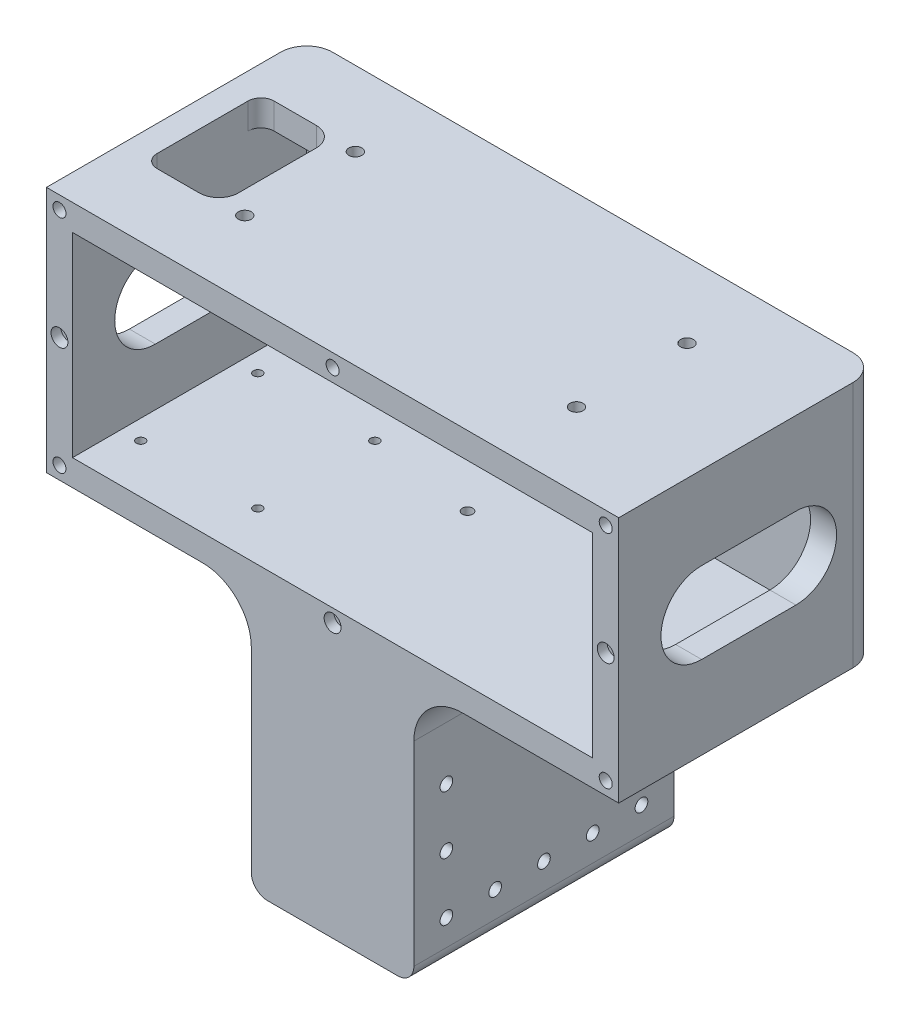
from build123d import *

# Parameters (mm, degrees)
SKETCH_1_W           = 176
SKETCH_1_H           = 80
EXTRUDE_1_DEPTH      = 76
SKETCH_3_W           = 160
SKETCH_3_H           = 60
CUT_EXTRUDE_1_DEPTH  = 72
FILLET_1_R           = 8
SKETCH_5_R           = 1.35
CUT_EXTRUDE_3_DEPTH  = 119.186293622
SKETCH_6_R           = 2
CUT_EXTRUDE_4_DEPTH  = 8
SKETCH_7_R           = 1.6
CUT_EXTRUDE_5_DEPTH  = 119.186293622
SKETCH_8_R           = 2.5
SKETCH_8_R_2         = 3
CUT_EXTRUDE_6_DEPTH  = 4
CUT_EXTRUDE_8_DEPTH  = 2
SKETCH_11_R          = 2
CUT_EXTRUDE_9_DEPTH  = 8
SKETCH_11_3_R        = 2.6
CUT_EXTRUDE_10_DEPTH = 3
CUT_EXTRUDE1_DEPTH   = 196.836666698
SKETCH2_W            = 50
SKETCH2_H            = 80
BOSS_EXTRUDE1_DEPTH  = 80
FILLET1_R            = 15
FILLET2_R            = 5
SKETCH_4_R           = 1.95
CUT_EXTRUDE_2_DEPTH  = 8
CUT_EXTRUDE2_START   = -42
SKETCH_4_2_R         = 1.95
CUT_EXTRUDE2_DEPTH   = 8


with BuildPart() as part:
    # 草图1 → 凸台-拉伸1 (new body)
    with BuildSketch(Plane(origin=(0, 0, 0), x_dir=(1, 0, 0), z_dir=(0, 1, 0))):
        Rectangle(SKETCH_1_W, SKETCH_1_H)
    extrude(amount=EXTRUDE_1_DEPTH)

    # 草图3 → 切除-拉伸1 (cut)
    with BuildSketch(Plane.XY.offset(40)):
        with Locations((0, 38)):
            Rectangle(SKETCH_3_W, SKETCH_3_H)
    extrude(amount=-CUT_EXTRUDE_1_DEPTH, mode=Mode.SUBTRACT)

    # 圆角1
    fillet_1_edges = [part.edges().sort_by_distance(p)[0] for p in [
        (-88, 38, -40),
        (88, 38, -40),
    ]]
    fillet(fillet_1_edges, radius=FILLET_1_R)

    # 草图5 → 切除-拉伸3 (cut, through all)
    with BuildSketch(Plane(origin=(0, 8, 0), x_dir=(1, 0, 0), z_dir=(0, 1, 0))):
        with Locations(Location((-74, 11, 0), (0, 0, 180))):
            Circle(SKETCH_5_R)
        with Locations((-38, 11)):
            Circle(SKETCH_5_R)
        with Locations(Location((-38, -25, 0), (0, 0, 180))):
            Circle(SKETCH_5_R)
        with Locations((-74, -25)):
            Circle(SKETCH_5_R)
    extrude(amount=-CUT_EXTRUDE_3_DEPTH, mode=Mode.SUBTRACT)

    # 草图6 → 切除-拉伸4 (cut)
    with BuildSketch(Plane(origin=(0, 76, 0), x_dir=(1, 0, 0), z_dir=(0, 1, 0))):
        with BuildLine():
            ThreePointArc((-63, -18), (-67.242640687, -16.242640687), (-69, -12))
            Line((-69, -12), (-69, 12))
            ThreePointArc((-69, 12), (-67.242640687, 16.242640687), (-63, 18))
            Line((-63, 18), (-76, 18))
            ThreePointArc((-76, 18), (-78.828427125, 16.828427125), (-80, 14))
            Line((-80, 14), (-80, -14))
            ThreePointArc((-80, -14), (-78.828427125, -16.828427125), (-76, -18))
            Line((-76, -18), (-63, -18))
        make_face()
        with BuildLine():
            Line((-69, 12), (-69, -12))
            ThreePointArc((-69, -12), (-67.242640687, -16.242640687), (-63, -18))
            Line((-63, -18), (-63, 18))
            ThreePointArc((-63, 18), (-67.242640687, 16.242640687), (-69, 12))
        make_face()
        with BuildLine():
            Line((-63, 18), (-63, -18))
            ThreePointArc((-63, -18), (-58.757359313, -16.242640687), (-57, -12))
            Line((-57, -12), (-57, 12))
            ThreePointArc((-57, 12), (-58.757359313, 16.242640687), (-63, 18))
        make_face()
        with Locations(Location((-50, 17, 0), (0, 0, 270))):
            Circle(SKETCH_6_R)
        with Locations(Location((-50, -17, 0), (0, 0, 270))):
            Circle(SKETCH_6_R)
        with Locations(Location((52, 17, 0), (0, 0, 270))):
            Circle(SKETCH_6_R)
        with Locations(Location((52, -17, 0), (0, 0, 270))):
            Circle(SKETCH_6_R)
    extrude(amount=-CUT_EXTRUDE_4_DEPTH, mode=Mode.SUBTRACT)

    # 草图7 → 切除-拉伸5 (cut, through all)
    with BuildSketch(Plane(origin=(0, 8, 0), x_dir=(1, 0, 0), z_dir=(0, 1, 0))):
        with Locations(Location((70, 23, 0), (0, 0, 180))):
            Circle(SKETCH_7_R)
        with Locations(Location((70, -10, 0), (0, 0, 180))):
            Circle(SKETCH_7_R)
        with Locations(Location((-5, 6.5, 0), (0, 0, 180))):
            Circle(SKETCH_7_R)
    extrude(amount=-CUT_EXTRUDE_5_DEPTH, mode=Mode.SUBTRACT)

    # 草图8 → 切除-拉伸6 (cut)
    with BuildSketch(Plane.XZ):
        with Locations(Location((-74, 25, 0), (0, 0, 270))):
            Circle(SKETCH_8_R)
        with Locations(Location((-38, 25, 0), (0, 0, 90))):
            Circle(SKETCH_8_R)
        with Locations(Location((-38, -11, 0), (0, 0, 270))):
            Circle(SKETCH_8_R)
        with Locations(Location((-74, -11, 0), (0, 0, 90))):
            Circle(SKETCH_8_R)
        with Locations(Location((-5, -6.5, 0), (0, 0, 270))):
            Circle(SKETCH_8_R_2)
        with Locations(Location((70, 10, 0), (0, 0, 270))):
            Circle(SKETCH_8_R_2)
        with Locations(Location((70, -23, 0), (0, 0, 270))):
            Circle(SKETCH_8_R_2)
    extrude(amount=-CUT_EXTRUDE_6_DEPTH, mode=Mode.SUBTRACT)

    # 草图10 → 切除-拉伸8 (cut)
    # profile 1 of 6: a face of its own
    with BuildSketch(Plane(origin=(0, 0, -40), x_dir=(-1, 0, 0), z_dir=(0, 0, -1))):
        with BuildLine():
            Line((-50.893333333, 27), (-61.16, 27))
            Line((-61.16, 27), (-61.16, 28.173333333))
            add(Edge.make_bspline(
                [(-61.16, 28.173333333), (-60.952112142, 28.180487852), (-60.555641127, 28.194132512), (-59.99587346, 28.244548421), (-59.499819668, 28.312277517), (-59.07290631, 28.397220013), (-58.724563275, 28.513301064), (-58.459894229, 28.646408041), (-58.286995174, 28.832568195), (-58.264772394, 28.978909316), (-58.254166667, 29.04875)],
                knots=[0, 0, 0, 0, 1.55077788, 2.957548773, 4.188379406, 5.283168379, 6.198199007, 6.917411296, 7.483339098, 8, 8, 8, 8], degree=3))
            add(Edge.make_bspline(
                [(-58.254166667, 29.04875), (-58.260585026, 29.097886579), (-58.27653201, 29.21997077), (-58.34533932, 29.429686108), (-58.465543904, 29.695288105), (-58.618736691, 30.0191066), (-58.801481266, 30.390189812), (-59.024378734, 30.785931448), (-59.265744563, 31.209475274), (-59.441892444, 31.495245314), (-59.532916667, 31.642916667)],
                knots=[0, 0, 0, 0, 0.408681915, 1.015406497, 1.812353963, 2.817067619, 3.973889607, 5.227672225, 6.567402679, 8, 8, 8, 8], degree=3))
            add(Edge.make_bspline(
                [(-59.532916667, 31.642916667), (-59.644543076, 31.81854873), (-59.877350015, 32.184845232), (-60.238193295, 32.757017928), (-60.628646688, 33.373137696), (-61.186551902, 34.243787218), (-61.886221131, 35.346284591), (-62.474632648, 36.209441376), (-62.764166667, 36.634166667)],
                knots=[0, 0, 0, 0, 0.629951914, 1.313821509, 2.047701607, 2.837979894, 4.444095054, 6, 6, 6, 6], degree=3))
            add(Edge.make_bspline(
                [(-62.764166667, 36.634166667), (-63.009835353, 36.315785189), (-63.522447559, 35.651450496), (-64.298154348, 34.59492817), (-65.128057009, 33.450387269), (-65.835734143, 32.451764527), (-66.387065241, 31.653510431), (-66.756847548, 31.114182322), (-67.063209667, 30.634839465), (-67.32005826, 30.226011781), (-67.521171509, 29.883441054), (-67.656375705, 29.604831258), (-67.75746126, 29.397405203), (-67.775702759, 29.272365659), (-67.782916667, 29.222916667)],
                knots=[0, 0, 0, 0, 1.612784575, 3.365235798, 5.256389622, 7.28285987, 8.273760362, 9.147282428, 9.905311661, 10.554805674, 11.08452502, 11.495556935, 11.8005095, 12, 12, 12, 12], degree=3))
            add(Edge.make_bspline(
                [(-67.782916667, 29.222916667), (-67.777543085, 29.142299251), (-67.767176344, 28.98677174), (-67.661316359, 28.770686837), (-67.489923465, 28.595990823), (-67.299227519, 28.477726547), (-67.102875684, 28.411915187), (-66.914567164, 28.35441139), (-66.685570253, 28.311050915), (-66.417310947, 28.2771453), (-66.112259677, 28.237816954), (-65.766438834, 28.213037015), (-65.382964998, 28.189627347), (-65.11391683, 28.178925356), (-64.973333333, 28.173333333)],
                knots=[0, 0, 0, 0, 0.87771759, 1.693297064, 2.568939857, 3.530052873, 4.117451916, 4.83208502, 5.685064082, 6.664491151, 7.79324832, 9.051878884, 10.45954285, 12, 12, 12, 12], degree=3))
            Line((-64.973333333, 28.173333333), (-64.973333333, 27))
            Line((-64.973333333, 27), (-73.186666667, 27))
            Line((-73.186666667, 27), (-73.186666667, 28.173333333))
            add(Edge.make_bspline(
                [(-73.186666667, 28.173333333), (-73.03533938, 28.188226277), (-72.694055691, 28.221813867), (-72.160753978, 28.283688703), (-71.617685691, 28.373760749), (-71.287557056, 28.510226341), (-71.137916667, 28.572083333)],
                knots=[0, 0, 0, 0, 0.869842477, 1.961728483, 3.076094254, 4, 4, 4, 4], degree=3))
            add(Edge.make_bspline(
                [(-71.137916667, 28.572083333), (-71.009774798, 28.643272699), (-70.760417814, 28.781803263), (-70.421553975, 29.017507115), (-70.111669198, 29.24854916), (-69.758553642, 29.59216709), (-69.33824889, 30.063539395), (-69.026945226, 30.468965021), (-68.864583333, 30.680416667)],
                knots=[0, 0, 0, 0, 0.842303229, 1.639075457, 2.371817038, 3.061590333, 4.467458589, 6, 6, 6, 6], degree=3))
            add(Edge.make_bspline(
                [(-68.864583333, 30.680416667), (-68.686558781, 30.920825244), (-68.30940849, 31.430137941), (-67.695630293, 32.226380512), (-67.019598511, 33.111195462), (-66.288711741, 34.055247826), (-65.544036844, 35.016436805), (-64.828382469, 35.958246428), (-64.155835525, 36.852192487), (-63.727594315, 37.437333089), (-63.520416667, 37.720416667)],
                knots=[0, 0, 0, 0, 0.812243646, 1.72076224, 2.729689795, 3.835742579, 4.962534863, 6.031166572, 7.047503441, 8, 8, 8, 8], degree=3))
            add(Edge.make_bspline(
                [(-63.520416667, 37.720416667), (-63.680591655, 37.954333271), (-64.021303208, 38.451902149), (-64.567633105, 39.238551798), (-65.17171939, 40.115659567), (-65.836170012, 41.068492158), (-66.540999269, 42.084587468), (-67.266296542, 43.151932602), (-68.030818684, 44.243166048), (-68.541333578, 44.987614018), (-68.800416667, 45.365416667)],
                knots=[0, 0, 0, 0, 0.732313684, 1.557719685, 2.473978017, 3.483336423, 4.558335994, 5.668291013, 6.816672396, 8, 8, 8, 8], degree=3))
            add(Edge.make_bspline(
                [(-68.800416667, 45.365416667), (-68.903542432, 45.515678528), (-69.094513643, 45.793937697), (-69.370229979, 46.172114524), (-69.610386258, 46.479272062), (-69.827338515, 46.725756309), (-70.036524781, 46.938191298), (-70.280054972, 47.111912257), (-70.543848517, 47.286246289), (-70.739396562, 47.379790866), (-70.84, 47.427916667)],
                knots=[0, 0, 0, 0, 1.485103007, 2.750155792, 3.813775997, 4.660588893, 5.426569177, 6.235847683, 7.092398042, 8, 8, 8, 8], degree=3))
            add(Edge.make_bspline(
                [(-70.84, 47.427916667), (-70.906653124, 47.457009281), (-71.047839895, 47.518634184), (-71.287757308, 47.583409327), (-71.558892445, 47.649855836), (-71.857415254, 47.693098526), (-72.153439237, 47.739668619), (-72.429010498, 47.773681985), (-72.671134617, 47.809860562), (-72.822968531, 47.821344592), (-72.893333333, 47.826666667)],
                knots=[0, 0, 0, 0, 0.830174623, 1.758502331, 2.834418257, 4.02009335, 5.203064799, 6.260108559, 7.193677397, 8, 8, 8, 8], degree=3))
            Line((-72.893333333, 47.826666667), (-72.893333333, 49))
            Line((-72.893333333, 49), (-62.626666667, 49))
            Line((-62.626666667, 49), (-62.626666667, 47.826666667))
            add(Edge.make_bspline(
                [(-62.626666667, 47.826666667), (-62.958752228, 47.806864988), (-63.633378221, 47.766638225), (-64.453510118, 47.646628022), (-65.054444563, 47.513621874), (-65.377991761, 47.385804399), (-65.612087545, 47.228198659), (-65.645889425, 47.077470627), (-65.660833333, 47.010833333)],
                knots=[0, 0, 0, 0, 1.823965672, 3.705354272, 4.551126633, 5.178536223, 5.63682852, 6, 6, 6, 6], degree=3))
            add(Edge.make_bspline(
                [(-65.660833333, 47.010833333), (-65.655289714, 46.952336547), (-65.642152941, 46.813716112), (-65.557865387, 46.585421012), (-65.439878611, 46.300006099), (-65.202736118, 45.838162208), (-64.838533425, 45.198669644), (-64.518242182, 44.679964688), (-64.35, 44.4075)],
                knots=[0, 0, 0, 0, 0.359449428, 0.851790998, 1.482307005, 2.258221073, 4.034523058, 6, 6, 6, 6], degree=3))
            add(Edge.make_bspline(
                [(-64.35, 44.4075), (-64.154184023, 44.099054343), (-63.742329382, 43.450308627), (-63.217039306, 42.613055084), (-62.750702473, 41.889073794), (-62.356766464, 41.291980913), (-61.920216487, 40.657701758), (-61.618361932, 40.219839308), (-61.4625, 39.99375)],
                knots=[0, 0, 0, 0, 1.246692748, 2.622136376, 3.372642514, 4.18523793, 5.062951616, 6, 6, 6, 6], degree=3))
            add(Edge.make_bspline(
                [(-61.4625, 39.99375), (-61.171672337, 40.382920525), (-60.606643453, 41.13901293), (-59.792869222, 42.246905218), (-59.049389241, 43.301779315), (-58.466608741, 44.134455793), (-58.0463771, 44.758950955), (-57.779081627, 45.176125126), (-57.54878641, 45.549935986), (-57.369831238, 45.884686319), (-57.214688894, 46.171908536), (-57.120318305, 46.423438805), (-57.042704649, 46.627469361), (-57.034169003, 46.753682421), (-57.030416667, 46.809166667)],
                knots=[0, 0, 0, 0, 2.140744858, 4.15910462, 6.056835027, 7.827150132, 8.637466942, 9.373214314, 10.010505793, 10.570870692, 11.046552371, 11.445326823, 11.756161342, 12, 12, 12, 12], degree=3))
            add(Edge.make_bspline(
                [(-57.030416667, 46.809166667), (-57.037002298, 46.886983573), (-57.050169707, 47.042571848), (-57.174551498, 47.255804721), (-57.382710808, 47.416825287), (-57.659808975, 47.552477742), (-58.027090234, 47.650855787), (-58.489210013, 47.73901374), (-59.056936513, 47.791808421), (-59.47022032, 47.814445788), (-59.693333333, 47.826666667)],
                knots=[0, 0, 0, 0, 0.600284519, 1.200217754, 1.848346211, 2.617089138, 3.581134332, 4.787833379, 6.265898252, 8, 8, 8, 8], degree=3))
            Line((-59.693333333, 47.826666667), (-59.693333333, 49))
            Line((-59.693333333, 49), (-51.48, 49))
            Line((-51.48, 49), (-51.48, 47.826666667))
            add(Edge.make_bspline(
                [(-51.48, 47.826666667), (-51.551838718, 47.82251661), (-51.706400252, 47.813587732), (-51.952370227, 47.789731883), (-52.23080896, 47.758089961), (-52.625874857, 47.69801973), (-53.09983943, 47.618242149), (-53.450644598, 47.487687235), (-53.61125, 47.427916667)],
                knots=[0, 0, 0, 0, 0.594910082, 1.279953456, 2.04301135, 2.911222787, 4.585897952, 6, 6, 6, 6], degree=3))
            add(Edge.make_bspline(
                [(-53.61125, 47.427916667), (-53.741930752, 47.363836106), (-53.990719674, 47.241840071), (-54.333505741, 47.042430096), (-54.618902368, 46.827492292), (-54.860029175, 46.593766864), (-55.085320409, 46.332066075), (-55.340807113, 46.037279069), (-55.626386372, 45.691776705), (-55.825409131, 45.442132744), (-55.930416667, 45.310416667)],
                knots=[0, 0, 0, 0, 1.097953283, 2.090274278, 2.987021028, 3.785909167, 4.618668917, 5.59131528, 6.729140082, 8, 8, 8, 8], degree=3))
            add(Edge.make_bspline(
                [(-55.930416667, 45.310416667), (-56.33030899, 44.80255797), (-57.102992771, 43.821258368), (-58.048040638, 42.588434372), (-58.79477748, 41.596221548), (-59.401473174, 40.793885853), (-60.059789197, 39.914146991), (-60.518261217, 39.303140199), (-60.756666667, 38.985416667)],
                knots=[0, 0, 0, 0, 1.462379986, 2.82565388, 3.514168065, 4.271809583, 5.101340983, 6, 6, 6, 6], degree=3))
            add(Edge.make_bspline(
                [(-60.756666667, 38.985416667), (-60.544452331, 38.681287429), (-60.106200655, 38.053218888), (-59.425459901, 37.08380398), (-58.718862296, 36.047323257), (-57.731401296, 34.60699026), (-56.50314759, 32.814365074), (-55.526856234, 31.383349403), (-55.050416667, 30.685)],
                knots=[0, 0, 0, 0, 0.66271119, 1.368589395, 2.116773407, 2.90432888, 4.489282734, 6, 6, 6, 6], degree=3))
            add(Edge.make_bspline(
                [(-55.050416667, 30.685), (-54.881972662, 30.455468543), (-54.542538827, 29.992936542), (-54.058533594, 29.471343442), (-53.674461537, 29.085702946), (-53.403688835, 28.852558671), (-53.172312154, 28.656454312), (-53.016397944, 28.556986235), (-52.946666667, 28.5125)],
                knots=[0, 0, 0, 0, 1.684639267, 3.394739792, 4.207221132, 4.905962465, 5.510701206, 6, 6, 6, 6], degree=3))
            add(Edge.make_bspline(
                [(-52.946666667, 28.5125), (-52.880214228, 28.478585874), (-52.740488572, 28.407276626), (-52.505044263, 28.333430124), (-52.240459092, 28.270847968), (-51.859368462, 28.231962666), (-51.407289013, 28.194608229), (-51.053823571, 28.179976733), (-50.893333333, 28.173333333)],
                knots=[0, 0, 0, 0, 0.63872946, 1.343019063, 2.108947838, 2.96693419, 4.622842869, 6, 6, 6, 6], degree=3))
            Line((-50.893333333, 28.173333333), (-50.893333333, 27))
        make_face()
    # profile 2 of 6: a face of its own
    with BuildSketch(Plane(origin=(0, 0, -40), x_dir=(-1, 0, 0), z_dir=(0, 0, -1))):
        with BuildLine():
            add(Edge.make_bspline(
                [(-27.133333333, 47.826666667), (-27.212857342, 47.821377914), (-27.389215363, 47.809649205), (-27.677947993, 47.770320759), (-28.017649529, 47.715994072), (-28.3923034, 47.640126894), (-28.77368194, 47.550879303), (-29.13079049, 47.434796194), (-29.453169119, 47.302169337), (-29.644708487, 47.185846617), (-29.736666667, 47.13)],
                knots=[0, 0, 0, 0, 0.703259667, 1.559597971, 2.570477534, 3.739349262, 4.933079466, 6.024732126, 7.051672565, 8, 8, 8, 8], degree=3))
            add(Edge.make_bspline(
                [(-29.736666667, 47.13), (-29.820446659, 47.058979321), (-30.001175682, 46.905774509), (-30.197416733, 46.568127207), (-30.356085973, 46.145400374), (-30.466465838, 45.63333105), (-30.551640323, 45.04821645), (-30.608172803, 44.397681697), (-30.645423019, 43.685296819), (-30.650622684, 43.189915204), (-30.653333333, 42.931666667)],
                knots=[0, 0, 0, 0, 0.59365717, 1.280628909, 2.090725397, 3.04605574, 4.121233866, 5.306016212, 6.595593068, 8, 8, 8, 8], degree=3))
            Line((-30.653333333, 42.931666667), (-30.653333333, 33.370833333))
            add(Edge.make_bspline(
                [(-30.653333333, 33.370833333), (-30.661264856, 33.075369451), (-30.676692499, 32.500661189), (-30.821227179, 31.670010948), (-31.059682665, 30.898503171), (-31.396855834, 30.192628211), (-31.810120626, 29.548589138), (-32.276625338, 28.956971842), (-32.812538022, 28.430792445), (-33.209040057, 28.128082554), (-33.407916667, 27.97625)],
                knots=[0, 0, 0, 0, 1.123463632, 2.18525468, 3.1964941, 4.187223885, 5.151611522, 6.103069636, 7.048541886, 8, 8, 8, 8], degree=3))
            add(Edge.make_bspline(
                [(-33.407916667, 27.97625), (-33.611775942, 27.84231288), (-34.013952201, 27.578079968), (-34.655965606, 27.254690283), (-35.307317886, 26.975375721), (-35.977697707, 26.770054429), (-36.643508462, 26.60798403), (-37.29973434, 26.50124366), (-37.940644237, 26.426455994), (-38.363820463, 26.417678858), (-38.573333333, 26.413333333)],
                knots=[0, 0, 0, 0, 1.068066247, 2.107095136, 3.145347213, 4.170194078, 5.175367246, 6.146150552, 7.082166492, 8, 8, 8, 8], degree=3))
            add(Edge.make_bspline(
                [(-38.573333333, 26.413333333), (-38.89439584, 26.419270956), (-39.51970329, 26.430835184), (-40.432175833, 26.527101676), (-41.289972675, 26.69274912), (-42.094558492, 26.914757774), (-42.837234909, 27.199627274), (-43.517835061, 27.532001708), (-44.143815016, 27.898089502), (-44.514799496, 28.190434262), (-44.696666667, 28.33375)],
                knots=[0, 0, 0, 0, 1.176901043, 2.292154872, 3.358808348, 4.37671394, 5.348288585, 6.270154977, 7.151980642, 8, 8, 8, 8], degree=3))
            add(Edge.make_bspline(
                [(-44.696666667, 28.33375), (-44.861804414, 28.48329714), (-45.187594266, 28.778329266), (-45.613887296, 29.270005801), (-45.976186096, 29.794380672), (-46.273948134, 30.347365476), (-46.503326528, 30.924733728), (-46.662169516, 31.517312142), (-46.770042937, 32.120243966), (-46.781106802, 32.528560762), (-46.786666667, 32.73375)],
                knots=[0, 0, 0, 0, 1.062308445, 2.095761364, 3.096693215, 4.097970101, 5.086158535, 6.05350405, 7.021837885, 8, 8, 8, 8], degree=3))
            Line((-46.786666667, 32.73375), (-46.786666667, 45.736666667))
            add(Edge.make_bspline(
                [(-46.786666667, 45.736666667), (-46.794251065, 45.902506997), (-46.808402999, 46.211952987), (-46.924545811, 46.58144425), (-47.084473269, 46.827332058), (-47.243034818, 47.006377505), (-47.456440467, 47.167363495), (-47.618296605, 47.263057286), (-47.703333333, 47.313333333)],
                knots=[0, 0, 0, 0, 1.539303726, 2.872228758, 3.529677156, 4.253335355, 5.082329234, 6, 6, 6, 6], degree=3))
            add(Edge.make_bspline(
                [(-47.703333333, 47.313333333), (-47.851189234, 47.384191065), (-48.173656406, 47.538728641), (-48.70872716, 47.662662767), (-49.230740857, 47.77437405), (-49.56989065, 47.810622795), (-49.72, 47.826666667)],
                knots=[0, 0, 0, 0, 0.93778721, 2.045272384, 3.134828041, 4, 4, 4, 4], degree=3))
            Line((-49.72, 47.826666667), (-49.72, 49))
            Line((-49.72, 49), (-40.626666667, 49))
            Line((-40.626666667, 49), (-40.626666667, 47.826666667))
            add(Edge.make_bspline(
                [(-40.626666667, 47.826666667), (-40.788901115, 47.815440659), (-41.154970645, 47.790110039), (-41.619433473, 47.708063662), (-42.010294801, 47.634387715), (-42.273235131, 47.574691765), (-42.491893937, 47.516466209), (-42.622084149, 47.47421317), (-42.68, 47.455416667)],
                knots=[0, 0, 0, 0, 1.398731851, 3.156130615, 4.05349442, 4.8221908, 5.47604492, 6, 6, 6, 6], degree=3))
            add(Edge.make_bspline(
                [(-42.68, 47.455416667), (-42.762487371, 47.421779791), (-42.919310109, 47.357830282), (-43.124422634, 47.216403142), (-43.283194048, 47.040292322), (-43.427918898, 46.763642436), (-43.531847965, 46.376365436), (-43.550451774, 46.05661092), (-43.56, 45.8925)],
                knots=[0, 0, 0, 0, 0.82896372, 1.576003205, 2.30251532, 3.016626784, 4.46881249, 6, 6, 6, 6], degree=3))
            Line((-43.56, 45.8925), (-43.56, 33.760416667))
            add(Edge.make_bspline(
                [(-43.56, 33.760416667), (-43.548818882, 33.459022702), (-43.525768011, 32.83767218), (-43.405970746, 32.058989001), (-43.248291136, 31.430593029), (-43.076316486, 30.970511193), (-42.861475374, 30.52471101), (-42.680139011, 30.24772865), (-42.588333333, 30.1075)],
                knots=[0, 0, 0, 0, 1.413827893, 2.91473222, 3.684662344, 4.448701255, 5.214619558, 6, 6, 6, 6], degree=3))
            add(Edge.make_bspline(
                [(-42.588333333, 30.1075), (-42.480488413, 29.968226218), (-42.263283112, 29.687721549), (-41.86563472, 29.322998512), (-41.423232097, 28.988198223), (-40.916085359, 28.695846441), (-40.330971385, 28.450369684), (-39.64753618, 28.29604232), (-38.874840727, 28.185627501), (-38.326307706, 28.177577728), (-38.037083333, 28.173333333)],
                knots=[0, 0, 0, 0, 0.819219763, 1.649951375, 2.503982557, 3.399980711, 4.370078102, 5.447182079, 6.65397864, 8, 8, 8, 8], degree=3))
            add(Edge.make_bspline(
                [(-38.037083333, 28.173333333), (-37.760101378, 28.177890698), (-37.226856619, 28.186664523), (-36.465010847, 28.297744707), (-35.768240034, 28.455010866), (-35.146075402, 28.698223086), (-34.589385932, 28.991777679), (-34.095307647, 29.329338769), (-33.655249269, 29.703075427), (-33.416115651, 29.99519463), (-33.297916667, 30.139583333)],
                knots=[0, 0, 0, 0, 1.248434101, 2.403481274, 3.466680099, 4.463775576, 5.407211776, 6.299967416, 7.159707754, 8, 8, 8, 8], degree=3))
            add(Edge.make_bspline(
                [(-33.297916667, 30.139583333), (-33.196036195, 30.278412174), (-32.995655345, 30.551463926), (-32.742868063, 30.986010708), (-32.535153923, 31.428858669), (-32.330409598, 32.031808104), (-32.156455963, 32.797492251), (-32.132066695, 33.420230777), (-32.12, 33.728333333)],
                knots=[0, 0, 0, 0, 0.805127519, 1.583543288, 2.347819015, 3.089226742, 4.559882449, 6, 6, 6, 6], degree=3))
            Line((-32.12, 33.728333333), (-32.12, 42.734583333))
            add(Edge.make_bspline(
                [(-32.12, 42.734583333), (-32.122097615, 43.008112607), (-32.126096976, 43.529629874), (-32.170419372, 44.271803533), (-32.248984035, 44.935579683), (-32.348302889, 45.520695924), (-32.484588887, 46.019525132), (-32.640338386, 46.431676028), (-32.83185002, 46.754702596), (-33.000963679, 46.905533163), (-33.077916667, 46.974166667)],
                knots=[0, 0, 0, 0, 1.473798797, 2.80997902, 4.003670744, 5.074288656, 6.004981979, 6.784625713, 7.446959613, 8, 8, 8, 8], degree=3))
            add(Edge.make_bspline(
                [(-33.077916667, 46.974166667), (-33.172857155, 47.037474093), (-33.372491529, 47.170592625), (-33.714150248, 47.334311025), (-34.106298879, 47.46823915), (-34.526759385, 47.581917209), (-34.942313287, 47.672736654), (-35.31949313, 47.74760672), (-35.643484695, 47.800299001), (-35.843079935, 47.818456273), (-35.933333333, 47.826666667)],
                knots=[0, 0, 0, 0, 0.909286387, 1.911985326, 3.010292361, 4.210400366, 5.383988903, 6.401970183, 7.277399488, 8, 8, 8, 8], degree=3))
            Line((-35.933333333, 47.826666667), (-35.933333333, 49))
            Line((-35.933333333, 49), (-27.133333333, 49))
            Line((-27.133333333, 49), (-27.133333333, 47.826666667))
        make_face()
    # profile 3 of 6: a face of its own
    with BuildSketch(Plane(origin=(0, 0, -40), x_dir=(-1, 0, 0), z_dir=(0, 0, -1))):
        with BuildLine():
            Line((-5.133333333, 27), (-14.185416667, 27))
            Line((-14.185416667, 27), (-14.185416667, 28.173333333))
            add(Edge.make_bspline(
                [(-14.185416667, 28.173333333), (-13.992754499, 28.186903011), (-13.623506906, 28.212910043), (-13.095943838, 28.277271766), (-12.619320778, 28.357406296), (-12.203635803, 28.456885697), (-11.854656412, 28.562221974), (-11.604366857, 28.690846178), (-11.422789671, 28.830314593), (-11.396708799, 28.952600653), (-11.385, 29.0075)],
                knots=[0, 0, 0, 0, 1.522462248, 2.917882252, 4.189202903, 5.328601012, 6.292288942, 7.041222743, 7.569564626, 8, 8, 8, 8], degree=3))
            add(Edge.make_bspline(
                [(-11.385, 29.0075), (-11.387329944, 29.056465308), (-11.392445111, 29.163963892), (-11.417096715, 29.33201436), (-11.445940526, 29.506374607), (-11.48869186, 29.616044775), (-11.50875, 29.6675)],
                knots=[0, 0, 0, 0, 0.871039179, 1.912282025, 3.020481126, 4, 4, 4, 4], degree=3))
            Line((-11.50875, 29.6675), (-13.232083333, 34.333333333))
            Line((-13.232083333, 34.333333333), (-21.097083333, 34.333333333))
            add(Edge.make_bspline(
                [(-21.097083333, 34.333333333), (-21.161322594, 34.168363134), (-21.286099295, 33.847929226), (-21.465103648, 33.38470129), (-21.621147333, 32.951782021), (-21.800383776, 32.430927878), (-21.998180935, 31.828180536), (-22.151313023, 31.358769462), (-22.224583333, 31.134166667)],
                knots=[0, 0, 0, 0, 0.939236489, 1.824349009, 2.634555097, 3.380463254, 4.746609722, 6, 6, 6, 6], degree=3))
            add(Edge.make_bspline(
                [(-22.224583333, 31.134166667), (-22.280715509, 30.945399306), (-22.381455223, 30.606620884), (-22.482101771, 30.143446848), (-22.544739545, 29.776149296), (-22.554755006, 29.560724653), (-22.559166667, 29.465833333)],
                knots=[0, 0, 0, 0, 1.384376075, 2.484522436, 3.332454899, 4, 4, 4, 4], degree=3))
            add(Edge.make_bspline(
                [(-22.559166667, 29.465833333), (-22.547290414, 29.371144259), (-22.522414161, 29.172806505), (-22.311125296, 28.915057191), (-21.993987226, 28.706459571), (-21.575321071, 28.537829749), (-21.084177675, 28.405192372), (-20.550785011, 28.28852912), (-19.983637754, 28.211386263), (-19.595482576, 28.186222431), (-19.396666667, 28.173333333)],
                knots=[0, 0, 0, 0, 0.616631876, 1.291610267, 2.09964896, 3.103309702, 4.241537626, 5.443230288, 6.690403929, 8, 8, 8, 8], degree=3))
            Line((-19.396666667, 28.173333333), (-19.396666667, 27))
            Line((-19.396666667, 27), (-27.426666667, 27))
            Line((-27.426666667, 27), (-27.426666667, 28.173333333))
            add(Edge.make_bspline(
                [(-27.426666667, 28.173333333), (-27.276539545, 28.190912135), (-26.943239288, 28.229939187), (-26.431501412, 28.343719487), (-25.912130322, 28.488222504), (-25.603280328, 28.658376018), (-25.460416667, 28.737083333)],
                knots=[0, 0, 0, 0, 0.879562297, 1.952734036, 3.053003347, 4, 4, 4, 4], degree=3))
            add(Edge.make_bspline(
                [(-25.460416667, 28.737083333), (-25.363491115, 28.806415036), (-25.176518334, 28.940158316), (-24.916143242, 29.149560984), (-24.697740054, 29.370033679), (-24.504473865, 29.598001795), (-24.337889353, 29.854728724), (-24.173329899, 30.14424334), (-24.007588652, 30.473883677), (-23.908215614, 30.711823173), (-23.85625, 30.83625)],
                knots=[0, 0, 0, 0, 1.063050284, 2.050661185, 2.975742165, 3.827229948, 4.711668566, 5.700501003, 6.797512097, 8, 8, 8, 8], degree=3))
            add(Edge.make_bspline(
                [(-23.85625, 30.83625), (-23.575648925, 31.534040232), (-22.997930381, 32.97069316), (-22.126651948, 35.194942882), (-21.203382653, 37.540217432), (-20.416118467, 39.564015841), (-19.777261306, 41.209930169), (-19.305519515, 42.424646216), (-18.844751971, 43.604674137), (-18.403718998, 44.75188412), (-17.96987755, 45.862939183), (-17.555918438, 46.940305234), (-17.144399049, 47.979657089), (-16.881397845, 48.663676117), (-16.752083333, 49)],
                knots=[0, 0, 0, 0, 1.388211397, 2.858133975, 4.409234111, 6.040487558, 6.866335122, 7.668090499, 8.445753791, 9.204583141, 9.936690537, 10.647334753, 11.334910858, 12, 12, 12, 12], degree=3))
            Line((-16.752083333, 49), (-15.532916667, 49))
            Line((-15.532916667, 49), (-8.31875, 30.364166667))
            add(Edge.make_bspline(
                [(-8.31875, 30.364166667), (-8.243450856, 30.182653505), (-8.10376147, 29.845923753), (-7.814289749, 29.395932775), (-7.443182171, 29.015449607), (-7.150696169, 28.80426793), (-6.994166667, 28.69125)],
                knots=[0, 0, 0, 0, 1.083661826, 2.010329023, 2.935189362, 4, 4, 4, 4], degree=3))
            add(Edge.make_bspline(
                [(-6.994166667, 28.69125), (-6.859865453, 28.621563766), (-6.567011637, 28.469607735), (-6.080584643, 28.323668568), (-5.594380994, 28.213479502), (-5.275850286, 28.185743134), (-5.133333333, 28.173333333)],
                knots=[0, 0, 0, 0, 0.931184218, 2.030516657, 3.118814113, 4, 4, 4, 4], degree=3))
            Line((-5.133333333, 28.173333333), (-5.133333333, 27))
        make_face()
        Polygon((-13.8325, 35.8), (-17.20125, 44.416666667), (-20.519583333, 35.8), align=None, mode=Mode.SUBTRACT)
    # profile 4 of 6: a face of its own
    with BuildSketch(Plane(origin=(0, 0, -40), x_dir=(-1, 0, 0), z_dir=(0, 0, -1))):
        with BuildLine():
            add(Edge.make_bspline(
                [(18.04, 47.826666667), (17.964924728, 47.822221099), (17.796698263, 47.812259603), (17.521226541, 47.753743169), (17.191060136, 47.684384924), (16.829736888, 47.580527455), (16.469454488, 47.468741245), (16.149652478, 47.350125155), (15.883275283, 47.236252824), (15.736653728, 47.140963928), (15.670416667, 47.097916667)],
                knots=[0, 0, 0, 0, 0.721636794, 1.617022543, 2.699651884, 3.963875089, 5.226563525, 6.322642193, 7.242244757, 8, 8, 8, 8], degree=3))
            add(Edge.make_bspline(
                [(15.670416667, 47.097916667), (15.587649235, 47.022359857), (15.410728176, 46.860851995), (15.231641779, 46.512506046), (15.079564658, 46.092798587), (14.976930133, 45.584143492), (14.90076694, 44.999087717), (14.85637981, 44.336123668), (14.814783017, 43.601344509), (14.813830508, 43.086048908), (14.813333333, 42.817083333)],
                knots=[0, 0, 0, 0, 0.597115289, 1.276374863, 2.069944957, 2.992955396, 4.051532198, 5.23550416, 6.557033648, 8, 8, 8, 8], degree=3))
            Line((14.813333333, 42.817083333), (14.813333333, 26.706666667))
            Line((14.813333333, 26.706666667), (13.497916667, 26.706666667))
            Line((13.497916667, 26.706666667), (0.146666667, 44.769583333))
            Line((0.146666667, 44.769583333), (0.146666667, 33.480833333))
            add(Edge.make_bspline(
                [(0.146666667, 33.480833333), (0.148473363, 33.182841344), (0.151866911, 32.623117825), (0.197881973, 31.838573244), (0.267924527, 31.163361631), (0.365953561, 30.590926293), (0.497750223, 30.108917838), (0.664667488, 29.707516097), (0.848888238, 29.366836871), (1.01669364, 29.194000082), (1.095416667, 29.112916667)],
                knots=[0, 0, 0, 0, 1.564392426, 2.938425413, 4.124561296, 5.126873188, 5.985219305, 6.740483808, 7.409119581, 8, 8, 8, 8], degree=3))
            add(Edge.make_bspline(
                [(1.095416667, 29.112916667), (1.167024524, 29.055271515), (1.329907045, 28.924149206), (1.650677133, 28.771828952), (2.055177996, 28.616768357), (2.522617443, 28.477725003), (2.990302331, 28.358210076), (3.394729065, 28.261826304), (3.70754402, 28.195367878), (3.886495412, 28.179748868), (3.96, 28.173333333)],
                knots=[0, 0, 0, 0, 0.72261565, 1.64369474, 2.779885142, 4.139958371, 5.483669464, 6.584983551, 7.418779589, 8, 8, 8, 8], degree=3))
            Line((3.96, 28.173333333), (3.96, 27))
            Line((3.96, 27), (-4.546666667, 27))
            Line((-4.546666667, 27), (-4.546666667, 28.173333333))
            add(Edge.make_bspline(
                [(-4.546666667, 28.173333333), (-4.473174899, 28.183103859), (-4.303707207, 28.205634115), (-4.019849195, 28.269004177), (-3.670880916, 28.355656374), (-3.282466156, 28.468491897), (-2.902823305, 28.592795974), (-2.581009875, 28.712891975), (-2.340109226, 28.828335317), (-2.218928951, 28.918941555), (-2.167916667, 28.957083333)],
                knots=[0, 0, 0, 0, 0.705029105, 1.625755647, 2.76436342, 4.125947264, 5.472632914, 6.563097854, 7.395118884, 8, 8, 8, 8], degree=3))
            add(Edge.make_bspline(
                [(-2.167916667, 28.957083333), (-2.089312844, 29.035050575), (-1.926665905, 29.196380303), (-1.747418541, 29.50916464), (-1.601167339, 29.869927891), (-1.509296217, 30.21247185), (-1.460633755, 30.527383619), (-1.414637786, 30.805964568), (-1.393434619, 31.126580337), (-1.361728531, 31.483572984), (-1.348268865, 31.882820477), (-1.324507028, 32.319474418), (-1.325662988, 32.796422878), (-1.321933699, 33.12640084), (-1.32, 33.2975)],
                knots=[0, 0, 0, 0, 0.875884541, 1.812379285, 2.835440708, 3.965725206, 4.61806958, 5.366297751, 6.206749643, 7.168149523, 8.212859411, 9.378798593, 10.640862697, 12, 12, 12, 12], degree=3))
            Line((-1.32, 33.2975), (-1.32, 44.054583333))
            add(Edge.make_bspline(
                [(-1.32, 44.054583333), (-1.330637083, 44.29233865), (-1.352095166, 44.771960125), (-1.496030579, 45.355632168), (-1.649990697, 45.797853353), (-1.788065434, 46.095112712), (-1.944786339, 46.352544699), (-2.07123203, 46.49746363), (-2.13125, 46.56625)],
                knots=[0, 0, 0, 0, 1.587732995, 3.202918242, 3.994333894, 4.716204477, 5.390641143, 6, 6, 6, 6], degree=3))
            add(Edge.make_bspline(
                [(-2.13125, 46.56625), (-2.219585795, 46.649394489), (-2.401275941, 46.820407092), (-2.719413056, 47.043478862), (-3.075814966, 47.256553432), (-3.469708478, 47.433949116), (-3.858337096, 47.589698905), (-4.219989094, 47.71263833), (-4.541989943, 47.793939621), (-4.746482354, 47.81639669), (-4.84, 47.826666667)],
                knots=[0, 0, 0, 0, 0.958113034, 1.970658632, 3.064610846, 4.237432849, 5.381531405, 6.374795584, 7.256768056, 8, 8, 8, 8], degree=3))
            Line((-4.84, 47.826666667), (-4.84, 49))
            Line((-4.84, 49), (0.939583333, 49))
            Line((0.939583333, 49), (13.346666667, 32.21125))
            Line((13.346666667, 32.21125), (13.346666667, 42.638333333))
            add(Edge.make_bspline(
                [(13.346666667, 42.638333333), (13.344698746, 42.93936901), (13.340999967, 43.505176545), (13.296944393, 44.297660525), (13.221381104, 44.97903442), (13.117383646, 45.553661963), (12.988952862, 46.034228639), (12.823078476, 46.420679128), (12.642068649, 46.7342603), (12.478107882, 46.879631203), (12.4025, 46.946666667)],
                knots=[0, 0, 0, 0, 1.597899814, 3.003310992, 4.211516956, 5.234338353, 6.102170457, 6.84335817, 7.466633144, 8, 8, 8, 8], degree=3))
            add(Edge.make_bspline(
                [(12.4025, 46.946666667), (12.321083536, 46.99758922), (12.141551476, 47.109878928), (11.819851732, 47.245950666), (11.436613966, 47.388421315), (11.004829124, 47.516822005), (10.570619029, 47.6350423), (10.174521631, 47.734698129), (9.834183323, 47.795501091), (9.626658886, 47.81699891), (9.533333333, 47.826666667)],
                knots=[0, 0, 0, 0, 0.761894269, 1.680058823, 2.7668661, 4.010876332, 5.256425229, 6.342757932, 7.254723768, 8, 8, 8, 8], degree=3))
            Line((9.533333333, 47.826666667), (9.533333333, 49))
            Line((9.533333333, 49), (18.04, 49))
            Line((18.04, 49), (18.04, 47.826666667))
        make_face()
    # profile 5 of 6: a face of its own
    with BuildSketch(Plane(origin=(0, 0, -40), x_dir=(-1, 0, 0), z_dir=(0, 0, -1))):
        with BuildLine():
            add(Edge.make_bspline(
                [(50.013333333, 47.826666667), (49.873566856, 47.813960501), (49.568102007, 47.786190702), (49.10455658, 47.650193917), (48.623588176, 47.475339015), (48.323188904, 47.305308151), (48.175416667, 47.221666667)],
                knots=[0, 0, 0, 0, 0.86096443, 1.881669876, 2.957952264, 4, 4, 4, 4], degree=3))
            add(Edge.make_bspline(
                [(48.175416667, 47.221666667), (48.006815402, 47.107323144), (47.681225897, 46.886511924), (47.346695373, 46.522475687), (47.129400074, 46.194415923), (46.984753111, 45.90465274), (46.841127836, 45.577149975), (46.763200245, 45.338703286), (46.7225, 45.214166667)],
                knots=[0, 0, 0, 0, 1.439891059, 2.780604389, 3.468200902, 4.223538327, 5.07218451, 6, 6, 6, 6], degree=3))
            add(Edge.make_bspline(
                [(46.7225, 45.214166667), (46.629082687, 44.910206978), (46.438551886, 44.29026105), (46.151335045, 43.340575682), (45.847088199, 42.356160237), (45.536478954, 41.331758795), (45.21001859, 40.27073837), (44.877223079, 39.169726229), (44.527117581, 38.034067466), (44.048037416, 36.454743073), (43.422083788, 34.422541139), (42.661498067, 31.91714143), (41.854878129, 29.339537864), (41.313740776, 27.592909288), (41.039166667, 26.706666667)],
                knots=[0, 0, 0, 0, 0.591289332, 1.205973777, 1.844883504, 2.507187773, 3.196433954, 3.909075619, 4.645942073, 5.406203494, 6.977893233, 8.599919658, 10.274792845, 12, 12, 12, 12], degree=3))
            Line((41.039166667, 26.706666667), (39.829166667, 26.706666667))
            Line((39.829166667, 26.706666667), (34.054166667, 43.6925))
            Line((34.054166667, 43.6925), (28.334166667, 26.706666667))
            Line((28.334166667, 26.706666667), (26.968333333, 26.706666667))
            add(Edge.make_bspline(
                [(26.968333333, 26.706666667), (26.712122469, 27.617350996), (26.194870815, 29.455887299), (25.403135378, 32.237674813), (24.608244263, 35.072870182), (23.943006103, 37.444657664), (23.416364433, 39.294728588), (23.062432202, 40.57185467), (22.734081563, 41.727131062), (22.447737433, 42.762538874), (22.189586391, 43.677262135), (21.965153612, 44.471320491), (21.777737738, 45.147166556), (21.662473173, 45.55642027), (21.610416667, 45.74125)],
                knots=[0, 0, 0, 0, 1.722305349, 3.477078507, 5.265484485, 7.082924656, 7.961649331, 8.767411953, 9.495609703, 10.1481696, 10.723163793, 11.225949047, 11.65041825, 12, 12, 12, 12], degree=3))
            add(Edge.make_bspline(
                [(21.610416667, 45.74125), (21.557608804, 45.893315418), (21.453878949, 46.192015711), (21.206446574, 46.600574042), (20.881808451, 46.972970736), (20.6083422, 47.169021254), (20.464583333, 47.272083333)],
                knots=[0, 0, 0, 0, 0.986884104, 1.938524711, 2.916300094, 4, 4, 4, 4], degree=3))
            add(Edge.make_bspline(
                [(20.464583333, 47.272083333), (20.328320497, 47.354608363), (20.04556214, 47.525855658), (19.564997763, 47.664649245), (19.091065755, 47.779179299), (18.775419662, 47.811455852), (18.626666667, 47.826666667)],
                knots=[0, 0, 0, 0, 0.982187712, 2.038133012, 3.075440507, 4, 4, 4, 4], degree=3))
            Line((18.626666667, 47.826666667), (18.626666667, 49))
            Line((18.626666667, 49), (27.564166667, 49))
            Line((27.564166667, 49), (27.564166667, 47.826666667))
            add(Edge.make_bspline(
                [(27.564166667, 47.826666667), (27.374660023, 47.815494252), (27.010483486, 47.794024126), (26.487046718, 47.746357585), (26.009430855, 47.673620755), (25.581885268, 47.604141518), (25.224698917, 47.5097848), (24.954483896, 47.393074707), (24.770523645, 47.227984929), (24.747040696, 47.088622183), (24.73625, 47.024583333)],
                knots=[0, 0, 0, 0, 1.473060029, 2.830792037, 4.076456292, 5.220558738, 6.192730364, 6.929737252, 7.508201463, 8, 8, 8, 8], degree=3))
            add(Edge.make_bspline(
                [(24.73625, 47.024583333), (24.740135268, 46.964931181), (24.749133801, 46.826772939), (24.780711821, 46.612865938), (24.81914108, 46.399209748), (24.847528123, 46.263702094), (24.86, 46.204166667)],
                knots=[0, 0, 0, 0, 0.86342779, 1.999754576, 3.1211901, 4, 4, 4, 4], degree=3))
            add(Edge.make_bspline(
                [(24.86, 46.204166667), (24.891746638, 46.081854084), (24.960086105, 45.818557642), (25.077673434, 45.396583312), (25.200804737, 44.916124716), (25.358408344, 44.385957013), (25.51316294, 43.79643334), (25.70086476, 43.156846467), (25.89551136, 42.459058632), (26.113590561, 41.701598099), (26.354850317, 40.867836919), (26.620467378, 39.945430039), (26.90778644, 38.923594967), (27.231355926, 37.80844052), (27.571410845, 36.591933689), (27.950777251, 35.282977826), (28.347300926, 33.874824697), (28.622728968, 32.904807645), (28.765, 32.40375)],
                knots=[0, 0, 0, 0, 0.422899283, 0.910355041, 1.465982518, 2.082625816, 2.761117455, 3.505583824, 4.31326235, 5.185552473, 6.143530298, 7.218091164, 8.398002008, 9.695902627, 11.104072167, 12.625312585, 14.256821436, 16, 16, 16, 16], degree=3))
            Line((28.765, 32.40375), (34.173333333, 48.706666667))
            Line((34.173333333, 48.706666667), (35.690416667, 48.706666667))
            Line((35.690416667, 48.706666667), (41.479166667, 31.876666667))
            add(Edge.make_bspline(
                [(41.479166667, 31.876666667), (41.65949561, 32.499984899), (42.008605392, 33.706704623), (42.513589802, 35.45534188), (42.975126484, 37.08325888), (43.403739102, 38.590506657), (43.795096918, 39.986423934), (44.146355848, 41.276337886), (44.465277967, 42.461216083), (44.659152922, 43.217182627), (44.751666667, 43.577916667)],
                knots=[0, 0, 0, 0, 1.281660521, 2.481244648, 3.595024064, 4.62383106, 5.576382031, 6.458512539, 7.264429091, 8, 8, 8, 8], degree=3))
            add(Edge.make_bspline(
                [(44.751666667, 43.577916667), (44.80891108, 43.800801464), (44.913076837, 44.206377527), (45.044998258, 44.760005477), (45.150198486, 45.19552304), (45.225880993, 45.614559837), (45.289462942, 46.023407817), (45.301019822, 46.32770434), (45.30625, 46.465416667)],
                knots=[0, 0, 0, 0, 1.405582702, 2.557692164, 3.476813567, 4.141241921, 5.158801099, 6, 6, 6, 6], degree=3))
            add(Edge.make_bspline(
                [(45.30625, 46.465416667), (45.296790859, 46.551106906), (45.277404396, 46.726728633), (45.130861833, 46.971215833), (44.891954559, 47.17867716), (44.56807583, 47.365692398), (44.146012295, 47.531774786), (43.614857587, 47.656741457), (42.976186531, 47.761498322), (42.512338492, 47.803878086), (42.262916667, 47.826666667)],
                knots=[0, 0, 0, 0, 0.572127446, 1.172572406, 1.85345695, 2.674901271, 3.666964323, 4.880780938, 6.322723717, 8, 8, 8, 8], degree=3))
            Line((42.262916667, 47.826666667), (42.262916667, 49))
            Line((42.262916667, 49), (50.013333333, 49))
            Line((50.013333333, 49), (50.013333333, 47.826666667))
        make_face()
    # profile 6 of 6: a face of its own
    with BuildSketch(Plane(origin=(0, 0, -40), x_dir=(-1, 0, 0), z_dir=(0, 0, -1))):
        with BuildLine():
            add(Edge.make_bspline(
                [(73.186666667, 47.826666667), (73.107142658, 47.821377914), (72.930784637, 47.809649205), (72.642052007, 47.770320759), (72.302350471, 47.715994072), (71.9276966, 47.640126894), (71.54631806, 47.550879303), (71.18920951, 47.434796194), (70.866830881, 47.302169337), (70.675291513, 47.185846617), (70.583333333, 47.13)],
                knots=[0, 0, 0, 0, 0.703259667, 1.559597971, 2.570477534, 3.739349262, 4.933079466, 6.024732126, 7.051672565, 8, 8, 8, 8], degree=3))
            add(Edge.make_bspline(
                [(70.583333333, 47.13), (70.499553341, 47.058979321), (70.318824318, 46.905774509), (70.122583267, 46.568127207), (69.963914027, 46.145400374), (69.853534162, 45.63333105), (69.768359677, 45.04821645), (69.711827197, 44.397681697), (69.674576981, 43.685296819), (69.669377316, 43.189915204), (69.666666667, 42.931666667)],
                knots=[0, 0, 0, 0, 0.59365717, 1.280628909, 2.090725397, 3.04605574, 4.121233866, 5.306016212, 6.595593068, 8, 8, 8, 8], degree=3))
            Line((69.666666667, 42.931666667), (69.666666667, 33.370833333))
            add(Edge.make_bspline(
                [(69.666666667, 33.370833333), (69.658735144, 33.075369451), (69.643307501, 32.500661189), (69.498772821, 31.670010948), (69.260317335, 30.898503171), (68.923144166, 30.192628211), (68.509879374, 29.548589138), (68.043374662, 28.956971842), (67.507461978, 28.430792445), (67.110959943, 28.128082554), (66.912083333, 27.97625)],
                knots=[0, 0, 0, 0, 1.123463632, 2.18525468, 3.1964941, 4.187223885, 5.151611522, 6.103069636, 7.048541886, 8, 8, 8, 8], degree=3))
            add(Edge.make_bspline(
                [(66.912083333, 27.97625), (66.708224058, 27.84231288), (66.306047799, 27.578079968), (65.664034394, 27.254690283), (65.012682114, 26.975375721), (64.342302293, 26.770054429), (63.676491538, 26.60798403), (63.02026566, 26.50124366), (62.379355763, 26.426455994), (61.956179537, 26.417678858), (61.746666667, 26.413333333)],
                knots=[0, 0, 0, 0, 1.068066247, 2.107095136, 3.145347213, 4.170194078, 5.175367246, 6.146150552, 7.082166492, 8, 8, 8, 8], degree=3))
            add(Edge.make_bspline(
                [(61.746666667, 26.413333333), (61.42560416, 26.419270956), (60.80029671, 26.430835184), (59.887824167, 26.527101676), (59.030027325, 26.69274912), (58.225441508, 26.914757774), (57.482765091, 27.199627274), (56.802164939, 27.532001708), (56.176184984, 27.898089502), (55.805200504, 28.190434262), (55.623333333, 28.33375)],
                knots=[0, 0, 0, 0, 1.176901043, 2.292154872, 3.358808348, 4.37671394, 5.348288585, 6.270154977, 7.151980642, 8, 8, 8, 8], degree=3))
            add(Edge.make_bspline(
                [(55.623333333, 28.33375), (55.458195586, 28.48329714), (55.132405734, 28.778329266), (54.706112704, 29.270005801), (54.343813904, 29.794380672), (54.046051866, 30.347365476), (53.816673472, 30.924733728), (53.657830484, 31.517312142), (53.549957063, 32.120243966), (53.538893198, 32.528560762), (53.533333333, 32.73375)],
                knots=[0, 0, 0, 0, 1.062308445, 2.095761364, 3.096693215, 4.097970101, 5.086158535, 6.05350405, 7.021837885, 8, 8, 8, 8], degree=3))
            Line((53.533333333, 32.73375), (53.533333333, 45.736666667))
            add(Edge.make_bspline(
                [(53.533333333, 45.736666667), (53.525748935, 45.902506997), (53.511597001, 46.211952987), (53.395454189, 46.58144425), (53.235526731, 46.827332058), (53.076965182, 47.006377505), (52.863559533, 47.167363495), (52.701703395, 47.263057286), (52.616666667, 47.313333333)],
                knots=[0, 0, 0, 0, 1.539303726, 2.872228758, 3.529677156, 4.253335355, 5.082329234, 6, 6, 6, 6], degree=3))
            add(Edge.make_bspline(
                [(52.616666667, 47.313333333), (52.468810766, 47.384191065), (52.146343594, 47.538728641), (51.61127284, 47.662662767), (51.089259143, 47.77437405), (50.75010935, 47.810622795), (50.6, 47.826666667)],
                knots=[0, 0, 0, 0, 0.93778721, 2.045272384, 3.134828041, 4, 4, 4, 4], degree=3))
            Line((50.6, 47.826666667), (50.6, 49))
            Line((50.6, 49), (59.693333333, 49))
            Line((59.693333333, 49), (59.693333333, 47.826666667))
            add(Edge.make_bspline(
                [(59.693333333, 47.826666667), (59.531098885, 47.815440659), (59.165029355, 47.790110039), (58.700566527, 47.708063662), (58.309705199, 47.634387715), (58.046764869, 47.574691765), (57.828106063, 47.516466209), (57.697915851, 47.47421317), (57.64, 47.455416667)],
                knots=[0, 0, 0, 0, 1.398731851, 3.156130615, 4.05349442, 4.8221908, 5.47604492, 6, 6, 6, 6], degree=3))
            add(Edge.make_bspline(
                [(57.64, 47.455416667), (57.557512629, 47.421779791), (57.400689891, 47.357830282), (57.195577366, 47.216403142), (57.036805952, 47.040292322), (56.892081102, 46.763642436), (56.788152035, 46.376365436), (56.769548226, 46.05661092), (56.76, 45.8925)],
                knots=[0, 0, 0, 0, 0.82896372, 1.576003205, 2.30251532, 3.016626784, 4.46881249, 6, 6, 6, 6], degree=3))
            Line((56.76, 45.8925), (56.76, 33.760416667))
            add(Edge.make_bspline(
                [(56.76, 33.760416667), (56.771181118, 33.459022702), (56.794231989, 32.83767218), (56.914029254, 32.058989001), (57.071708864, 31.430593029), (57.243683514, 30.970511193), (57.458524626, 30.52471101), (57.639860989, 30.24772865), (57.731666667, 30.1075)],
                knots=[0, 0, 0, 0, 1.413827893, 2.91473222, 3.684662344, 4.448701255, 5.214619558, 6, 6, 6, 6], degree=3))
            add(Edge.make_bspline(
                [(57.731666667, 30.1075), (57.839511587, 29.968226218), (58.056716888, 29.687721549), (58.45436528, 29.322998512), (58.896767903, 28.988198223), (59.403914641, 28.695846441), (59.989028615, 28.450369684), (60.67246382, 28.29604232), (61.445159273, 28.185627501), (61.993692294, 28.177577728), (62.282916667, 28.173333333)],
                knots=[0, 0, 0, 0, 0.819219763, 1.649951375, 2.503982557, 3.399980711, 4.370078102, 5.447182079, 6.65397864, 8, 8, 8, 8], degree=3))
            add(Edge.make_bspline(
                [(62.282916667, 28.173333333), (62.559898622, 28.177890698), (63.093143381, 28.186664523), (63.854989153, 28.297744707), (64.551759966, 28.455010866), (65.173924598, 28.698223086), (65.730614068, 28.991777679), (66.224692353, 29.329338769), (66.664750731, 29.703075427), (66.903884349, 29.99519463), (67.022083333, 30.139583333)],
                knots=[0, 0, 0, 0, 1.248434101, 2.403481274, 3.466680099, 4.463775576, 5.407211776, 6.299967416, 7.159707754, 8, 8, 8, 8], degree=3))
            add(Edge.make_bspline(
                [(67.022083333, 30.139583333), (67.123963805, 30.278412174), (67.324344655, 30.551463926), (67.577131937, 30.986010708), (67.784846077, 31.428858669), (67.989590402, 32.031808104), (68.163544037, 32.797492251), (68.187933305, 33.420230777), (68.2, 33.728333333)],
                knots=[0, 0, 0, 0, 0.805127519, 1.583543288, 2.347819015, 3.089226742, 4.559882449, 6, 6, 6, 6], degree=3))
            Line((68.2, 33.728333333), (68.2, 42.734583333))
            add(Edge.make_bspline(
                [(68.2, 42.734583333), (68.197902385, 43.008112607), (68.193903024, 43.529629874), (68.149580628, 44.271803533), (68.071015965, 44.935579683), (67.971697111, 45.520695924), (67.835411113, 46.019525132), (67.679661614, 46.431676028), (67.48814998, 46.754702596), (67.319036321, 46.905533163), (67.242083333, 46.974166667)],
                knots=[0, 0, 0, 0, 1.473798797, 2.80997902, 4.003670744, 5.074288656, 6.004981979, 6.784625713, 7.446959613, 8, 8, 8, 8], degree=3))
            add(Edge.make_bspline(
                [(67.242083333, 46.974166667), (67.147142845, 47.037474093), (66.947508471, 47.170592625), (66.605849752, 47.334311025), (66.213701121, 47.46823915), (65.793240615, 47.581917209), (65.377686713, 47.672736654), (65.00050687, 47.74760672), (64.676515305, 47.800299001), (64.476920065, 47.818456273), (64.386666667, 47.826666667)],
                knots=[0, 0, 0, 0, 0.909286387, 1.911985326, 3.010292361, 4.210400366, 5.383988903, 6.401970183, 7.277399488, 8, 8, 8, 8], degree=3))
            Line((64.386666667, 47.826666667), (64.386666667, 49))
            Line((64.386666667, 49), (73.186666667, 49))
            Line((73.186666667, 49), (73.186666667, 47.826666667))
        make_face()
    extrude(amount=-CUT_EXTRUDE_8_DEPTH, mode=Mode.SUBTRACT)

    # 草图11 → 切除-拉伸9 (cut)
    with BuildSketch(Plane.XY.offset(40)):
        with Locations((-84, 72)):
            Circle(SKETCH_11_R)
        with Locations((-84, 4)):
            Circle(SKETCH_11_R)
        with Locations((84, 4)):
            Circle(SKETCH_11_R)
        with Locations((84, 72)):
            Circle(SKETCH_11_R)
        with Locations((0, 72)):
            Circle(SKETCH_11_R)
    extrude(amount=-CUT_EXTRUDE_9_DEPTH, mode=Mode.SUBTRACT)

    # 草图11<3> → 切除-拉伸10 (cut)
    with BuildSketch(Plane.XY.offset(40)):
        with Locations((-84, 38)):
            Circle(SKETCH_11_3_R)
        with Locations((0, 4)):
            Circle(SKETCH_11_3_R)
        with Locations((84, 38)):
            Circle(SKETCH_11_3_R)
    extrude(amount=-CUT_EXTRUDE_10_DEPTH, mode=Mode.SUBTRACT)

    # Sketch1 → Cut-Extrude1 (cut, through all)
    with BuildSketch(Plane.ZY.offset(88)):
        with BuildLine():
            Line((14.5, 25.5), (-14.5, 25.5))
            ThreePointArc((-14.5, 25.5), (-27, 38), (-14.5, 50.5))
            Line((-14.5, 50.5), (14.5, 50.5))
            ThreePointArc((14.5, 50.5), (27, 38), (14.5, 25.5))
        make_face()
    extrude(amount=-CUT_EXTRUDE1_DEPTH, mode=Mode.SUBTRACT)

    # Sketch2 → Boss-Extrude1 (add)
    with BuildSketch(Plane(origin=(0, 0, -40), x_dir=(-1, 0, 0), z_dir=(0, 0, -1))):
        with Locations((0, -40)):
            Rectangle(SKETCH2_W, SKETCH2_H)
    extrude(amount=-BOSS_EXTRUDE1_DEPTH)

    # Fillet1
    # the kernel refuses this fillet: 15 mm, written as the material it adds along each edge
    with BuildSketch(Plane(origin=(25, 0, -40), x_dir=(1, 0, 0), z_dir=(0, 0, 1))) as fillet1_piece_1:
        with BuildLine():
            CenterArc((FILLET1_R, -FILLET1_R), FILLET1_R, 90, 90)
            Line((0, -FILLET1_R), (0, 0))
            Line((0, 0), (FILLET1_R, 0))
        make_face()
    extrude(amount=80)
    with BuildSketch(Plane(origin=(-25, 0, -40), x_dir=(-1, 0, 0), z_dir=(0, 0, 1))) as fillet1_piece_2_section:
        with BuildLine():
            CenterArc((FILLET1_R, FILLET1_R), FILLET1_R, 180, 90)
            Line((0, FILLET1_R), (0, 0))
            Line((0, 0), (FILLET1_R, 0))
        make_face()
    fillet1_piece_2 = extrude(amount=80, mode=Mode.PRIVATE)
    fillet1_piece_2 = fillet1_piece_2 - Plane(origin=(-38, -3.40977258, 25), x_dir=(0, 0, 1), z_dir=(0, -1, 0)) * Cylinder(2.5, 220, mode=Mode.PRIVATE)
    fillet1_piece_2 = fillet1_piece_2 - Plane(origin=(-38, -3.40977258, -11), x_dir=(0, 0, -1), z_dir=(0, -1, 0)) * Cylinder(2.5, 220, mode=Mode.PRIVATE)
    add(fillet1_piece_2)

    # Fillet2
    fillet2_edges = [part.edges().sort_by_distance(p)[0] for p in [
        (25, -80, 0),
        (-25, -80, 0),
    ]]
    fillet(fillet2_edges, radius=FILLET2_R)

    # 草图4 → 切除-拉伸2 (cut)
    with BuildSketch(Plane.ZY.offset(25)):
        with Locations((-30, -31.4)):
            Circle(SKETCH_4_R)
        with Locations(Location((30, -31.4, 0), (0, 0, 180))):
            Circle(SKETCH_4_R)
        with Locations((30, -67)):
            Circle(SKETCH_4_R)
        with Locations(Location((-30, -67, 0), (0, 0, 180))):
            Circle(SKETCH_4_R)
        with Locations(Location((-15, -67, 0), (0, 0, 180))):
            Circle(SKETCH_4_R)
        with Locations(Location((0, -67, 0), (0, 0, 180))):
            Circle(SKETCH_4_R)
        with Locations(Location((15, -67, 0), (0, 0, 180))):
            Circle(SKETCH_4_R)
        with Locations(Location((-30, -49.2, 0), (0, 0, 180))):
            Circle(SKETCH_4_R)
        with Locations((30, -49.2)):
            Circle(SKETCH_4_R)
    extrude(amount=-CUT_EXTRUDE_2_DEPTH, mode=Mode.SUBTRACT)

    # 草图4<2> → Cut-Extrude2 (cut)
    with BuildSketch(Plane.ZY.offset(25).offset(CUT_EXTRUDE2_START)):
        with Locations((-30, -31.4)):
            Circle(SKETCH_4_2_R)
        with Locations(Location((30, -31.4, 0), (0, 0, 180))):
            Circle(SKETCH_4_2_R)
        with Locations((30, -67)):
            Circle(SKETCH_4_2_R)
        with Locations(Location((-30, -67, 0), (0, 0, 180))):
            Circle(SKETCH_4_2_R)
        with Locations(Location((-15, -67, 0), (0, 0, 180))):
            Circle(SKETCH_4_2_R)
        with Locations(Location((0, -67, 0), (0, 0, 180))):
            Circle(SKETCH_4_2_R)
        with Locations(Location((15, -67, 0), (0, 0, 180))):
            Circle(SKETCH_4_2_R)
        with Locations(Location((-30, -49.2, 0), (0, 0, 180))):
            Circle(SKETCH_4_2_R)
        with Locations((30, -49.2)):
            Circle(SKETCH_4_2_R)
    extrude(amount=-CUT_EXTRUDE2_DEPTH, mode=Mode.SUBTRACT)


solid = part.part
